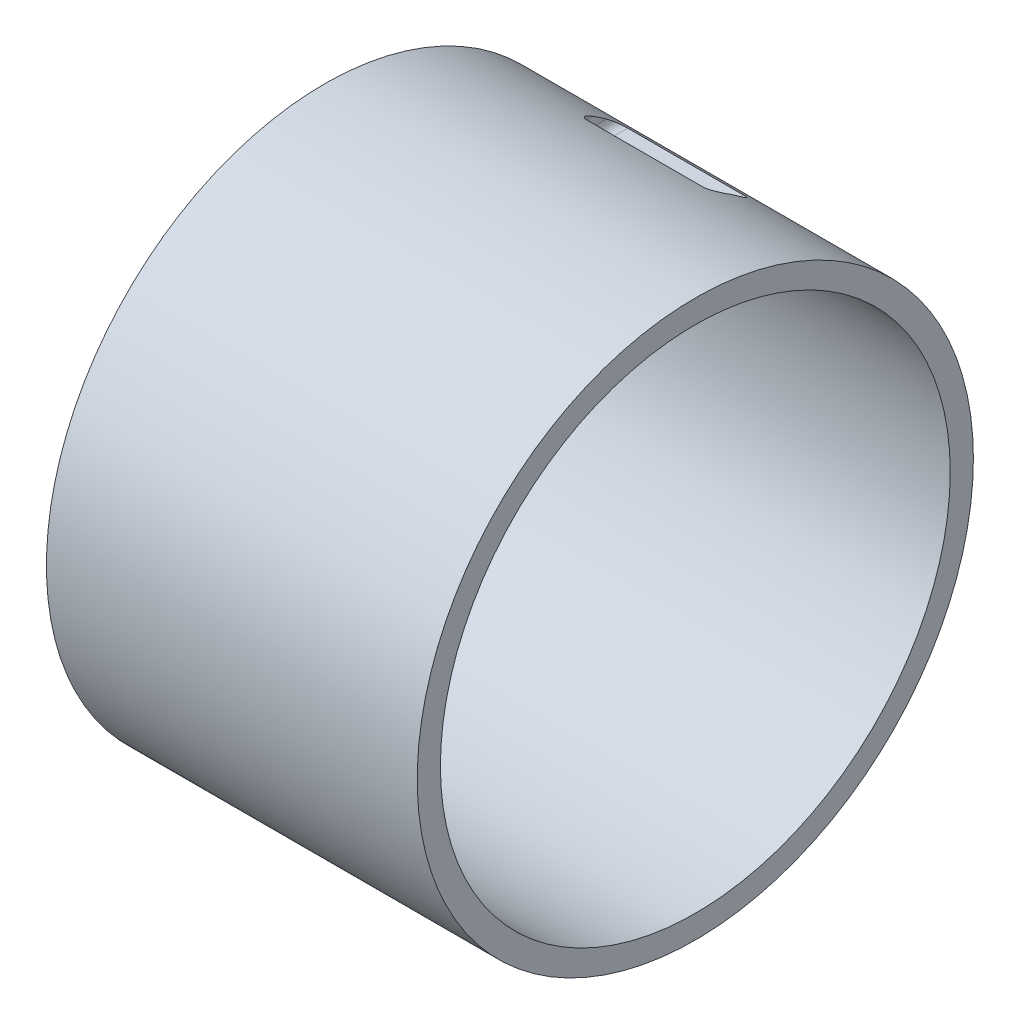
from build123d import *

# Parameters (mm, degrees)
SKETCH1_R               = 76.2
SKETCH1_R_2             = 69.85
BOSS_EXTRUDE1_DEPTH     = 50.8
CUT_EXTRUDE1_REACH      = 121.137
CUT_EXTRUDE1_END_RADIUS = 76.2
SKETCH4_W               = 36.83
SKETCH4_H               = 7.62
FILLET1_R               = 2.54


with BuildPart() as part:
    # Sketch1 → Boss-Extrude1 (new, symmetric)
    with BuildSketch(Plane(origin=(0, 0, 0), x_dir=(0, 0, -1), z_dir=(1, 0, 0))):
        Circle(SKETCH1_R)
        Circle(SKETCH1_R_2, mode=Mode.SUBTRACT)
    extrude(amount=BOSS_EXTRUDE1_DEPTH, both=True)

    # Cut-Extrude1: up to this cylinder (the profile starts inside it)
    cut_extrude1_end = Plane(origin=(0, 0, 0), z_dir=(-1, 0, 0)) * Cylinder(CUT_EXTRUDE1_END_RADIUS, 395.674, mode=Mode.PRIVATE)
    # Sketch4 → Cut-Extrude1 (cut, up to the surface)
    with BuildSketch(Plane.XY, mode=Mode.PRIVATE) as cut_extrude1_sk1:
        with Locations((0, 62.865)):
            Rectangle(SKETCH4_W, SKETCH4_H)
    cut_extrude1_tool1 = extrude(cut_extrude1_sk1.sketch, amount=-CUT_EXTRUDE1_REACH, mode=Mode.PRIVATE) & cut_extrude1_end
    add(cut_extrude1_tool1.solids().sort_by_distance((0, 62.865, 0))[0], mode=Mode.SUBTRACT)

    # Fillet1
    fillet1_edges = [part.edges().sort_by_distance(p)[0] for p in [
        (-18.415, 59.055, -42.729327968),
        (-18.415, 66.675, -28.855016844),
        (18.415, 66.675, -28.855016844),
        (18.415, 59.055, -42.729327968),
    ]]
    fillet(fillet1_edges, radius=FILLET1_R)


solid = part.part
